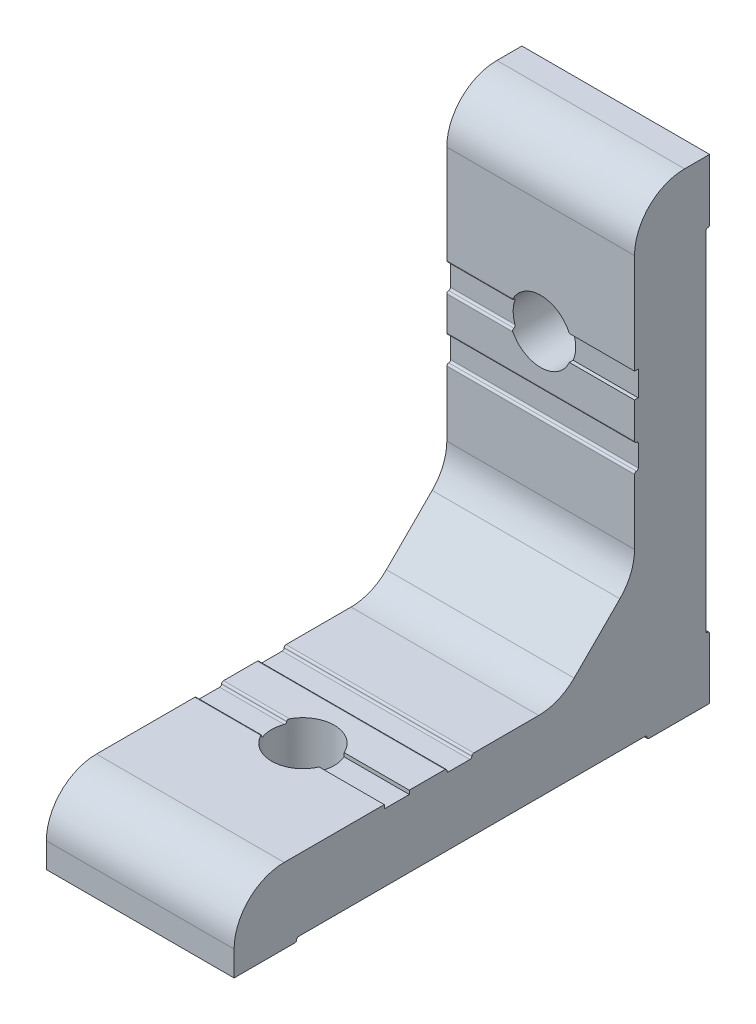
from build123d import *

# Parameters (mm, degrees)
ESBO_O1_W                  = 38
ESBO_O1_H                  = 38
RESSALTO_EXTRUS_O1_DEPTH   = 15
CORTE_EXTRUS_O1_DEPTH      = 52.28352562
ESBO_O7_W                  = 0.3
ESBO_O7_H                  = 28
ESBO_O7_W_2                = 28
ESBO_O7_H_2                = 0.3
ESBO_O7_W_3                = 2
ESBO_O7_H_3                = 2
CORTE_EXTRUS_O2_DEPTH      = 52.28352562
FURO_DE_DI_METRO_7_0_7_3_D = 5
FURO_DE_DI_METRO_7_0_7_2_D = 5
FILETE1_R                  = 4
FILETE2_R                  = 0.15


with BuildPart() as part:
    # Esboço1 → Ressalto-extrusão1 (new body)
    with BuildSketch(Plane(origin=(10, 0, 0), x_dir=(0, 0, -1), z_dir=(1, 0, 0))):
        with Locations((-12, 19)):
            Rectangle(ESBO_O1_W, ESBO_O1_H)
    extrude(amount=-RESSALTO_EXTRUS_O1_DEPTH)

    # Esboço2 → Corte-extrusão1 (cut, through all)
    with BuildSketch(Plane.ZY.offset(5)):
        Polygon((31, 38), (-1, 38), (-1, 12), (5, 6), (31, 6), align=None)
    extrude(amount=-CORTE_EXTRUS_O1_DEPTH, mode=Mode.SUBTRACT)

    # Esboço7 → Corte-extrusão2 (cut, through all)
    with BuildSketch(Plane(origin=(10, 0, 0), x_dir=(0, 0, -1), z_dir=(1, 0, 0))):
        with Locations((6.85, 19)):
            Rectangle(ESBO_O7_W, ESBO_O7_H)
        with Locations((-12, 0.15)):
            Rectangle(ESBO_O7_W_2, ESBO_O7_H_2)
        with Locations((-13, 5.85)):
            Rectangle(ESBO_O7_W_3, ESBO_O7_H_2)
        with Locations((1.15, 20)):
            Rectangle(ESBO_O7_W, ESBO_O7_H_3)
        with Locations((-18, 5.85)):
            Rectangle(ESBO_O7_W_3, ESBO_O7_H_2)
        with Locations((1.15, 25)):
            Rectangle(ESBO_O7_W, ESBO_O7_H_3)
    extrude(amount=-CORTE_EXTRUS_O2_DEPTH, mode=Mode.SUBTRACT)

    # Furo de diâmetro Ø7.0 (7)3 (through all)
    with Locations(Plane(origin=(0, 6, 0), x_dir=(1, 0, 0), z_dir=(0, 1, 0))):
        with Locations((2.5, -18)):
            Hole(FURO_DE_DI_METRO_7_0_7_3_D / 2)

    # Furo de diâmetro Ø7.0 (7)2 (through all)
    with Locations(Plane(origin=(0, 0, -7), x_dir=(-1, 0, 0), z_dir=(0, 0, -1))):
        with Locations((-2.5, 25)):
            Hole(FURO_DE_DI_METRO_7_0_7_2_D / 2)

    # Filete1
    filete1_edges = [part.edges().sort_by_distance(p)[0] for p in [
        (2.5, 6, 31),
        (2.5, 6, 5),
        (2.5, 12, -1),
        (2.5, 38, -1),
    ]]
    fillet(filete1_edges, radius=FILETE1_R)

    # Filete2
    filete2_edges = [part.edges().sort_by_distance(p)[0] for p in [
        (2.5, 5, -7),
        (2.5, 5, -6.7),
        (2.5, 33, -7),
        (2.5, 33, -6.7),
        (2.5, 0, 26),
        (2.5, 0.3, 26),
        (2.5, 0.3, -2),
        (2.5, 0, -2),
        (2.5, 19, -1.3),
        (2.5, 19, -1),
        (2.5, 21, -1.3),
        (2.5, 21, -1),
        (2.5, 5.7, 14),
        (2.5, 6, 14),
        (2.5, 5.7, 12),
        (2.5, 6, 12),
        (-2.395643924, 26, -1.3),
        (-2.395643924, 24, -1.3),
        (-2.395643924, 24, -1),
        (-2.395643924, 26, -1),
        (-2.395643924, 5.7, 19),
        (-2.395643924, 5.7, 17),
        (-2.395643924, 6, 17),
        (-2.395643924, 6, 19),
    ]]
    fillet(filete2_edges, radius=FILETE2_R - 0.0001)  # a hair under: the kernel refuses the full size


solid = part.part
